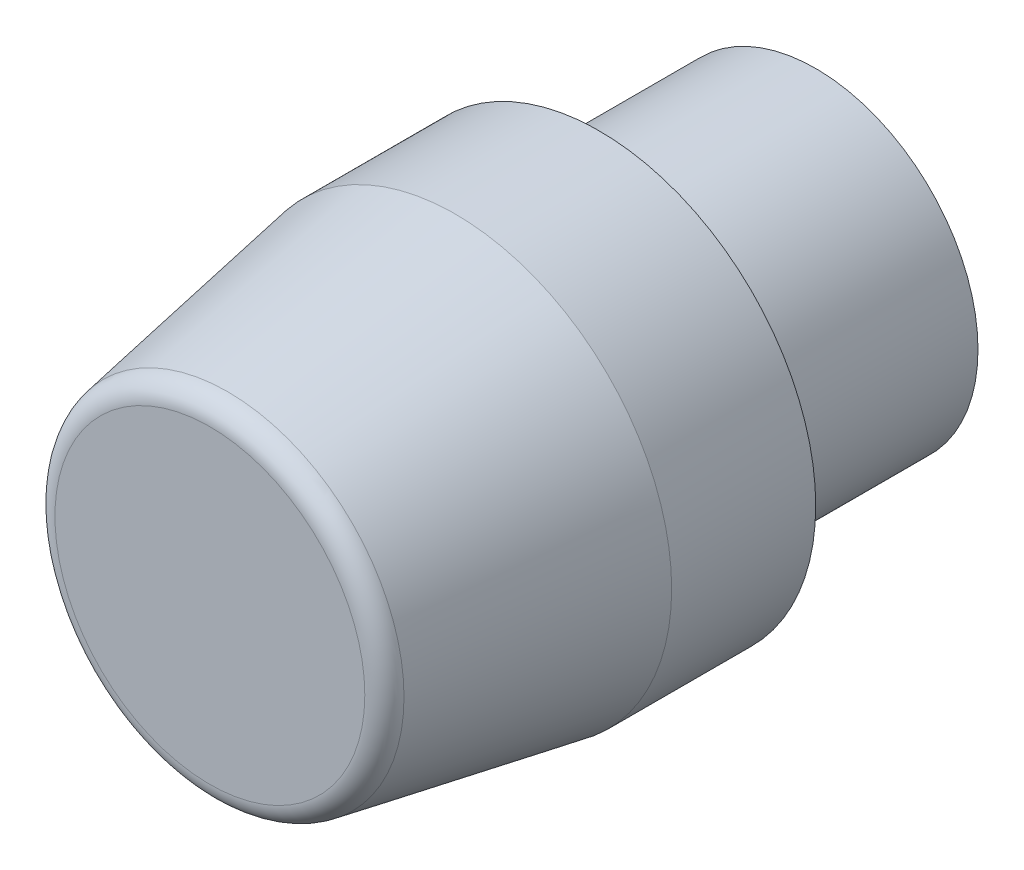
from build123d import *

# Parameters (mm, degrees)
SKETCH1_R           = 7.5
BOSS_EXTRUDE1_DEPTH = 10
SKETCH2_R           = 10
BOSS_EXTRUDE2_DEPTH = 18
CHAMFER1_SIZE       = 2
CHAMFER1_SIZE2      = 11.342563639
FILLET_1_R          = 1


with BuildPart() as part:
    # Sketch1 → Boss-Extrude1 (new body)
    with BuildSketch(Plane.XY):
        Circle(SKETCH1_R)
    extrude(amount=BOSS_EXTRUDE1_DEPTH)

    # Sketch2 → Boss-Extrude2 (add)
    with BuildSketch(Plane.XY.offset(10)):
        Circle(SKETCH2_R)
    extrude(amount=BOSS_EXTRUDE2_DEPTH)

    # Chamfer1
    chamfer1_edges = [part.edges().sort_by_distance(p)[0] for p in [
        (-10, 0, 28),
    ]]
    chamfer1_side = [part.faces().sort_by_distance(p)[0] for p in [
        (0, 0, 28),
    ]]
    chamfer(chamfer1_edges, length=CHAMFER1_SIZE, length2=CHAMFER1_SIZE2, reference=chamfer1_side[0])

    # Скругление1
    fillet_1_edges = [part.edges().sort_by_distance(p)[0] for p in [
        (-8, 0, 28),
    ]]
    fillet(fillet_1_edges, radius=FILLET_1_R)


solid = part.part
